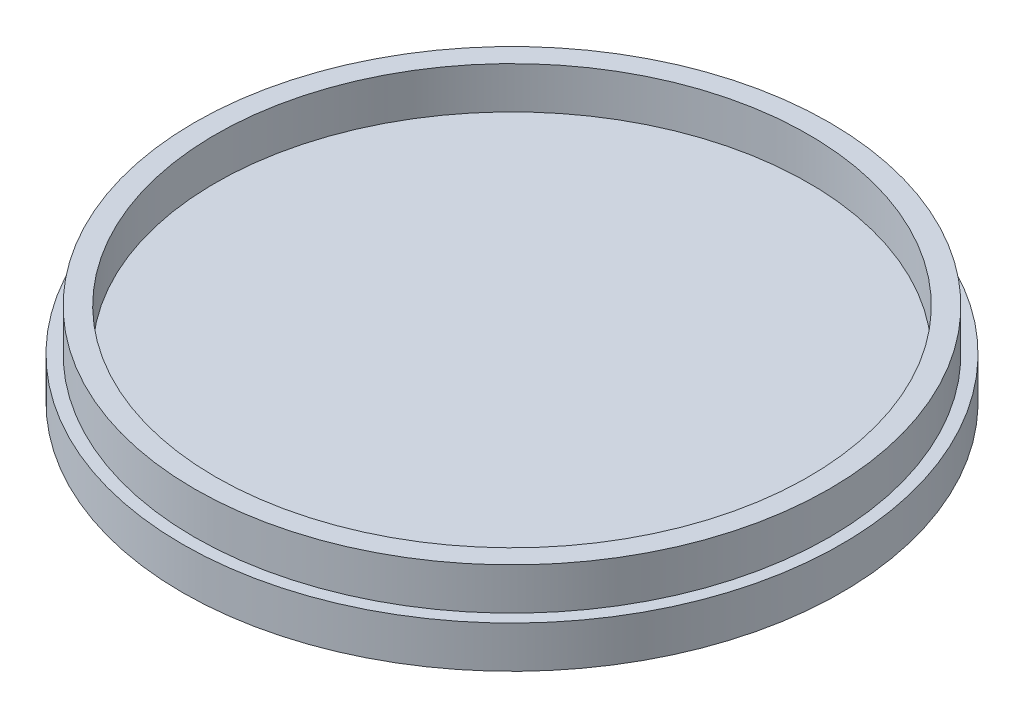
from build123d import *

# Parameters (mm, degrees)
SKETCH1_R           = 37.95
SKETCH1_R_2         = 35.45
BOSS_EXTRUDE1_DEPTH = 5
SKETCH1_4_R         = 39.4
BOSS_EXTRUDE2_DEPTH = 5


with BuildPart() as part:
    # Sketch1 → Boss-Extrude1 (new body)
    with BuildSketch(Plane(origin=(0, 0, 0), x_dir=(1, 0, 0), z_dir=(0, 1, 0))):
        Circle(SKETCH1_R)
        Circle(SKETCH1_R_2, mode=Mode.SUBTRACT)
    extrude(amount=BOSS_EXTRUDE1_DEPTH)

    # Sketch1<4> → Boss-Extrude2 (add)
    with BuildSketch(Plane(origin=(0, 0, 0), x_dir=(1, 0, 0), z_dir=(0, 1, 0))):
        Circle(SKETCH1_4_R)
    extrude(amount=-BOSS_EXTRUDE2_DEPTH)


solid = part.part
